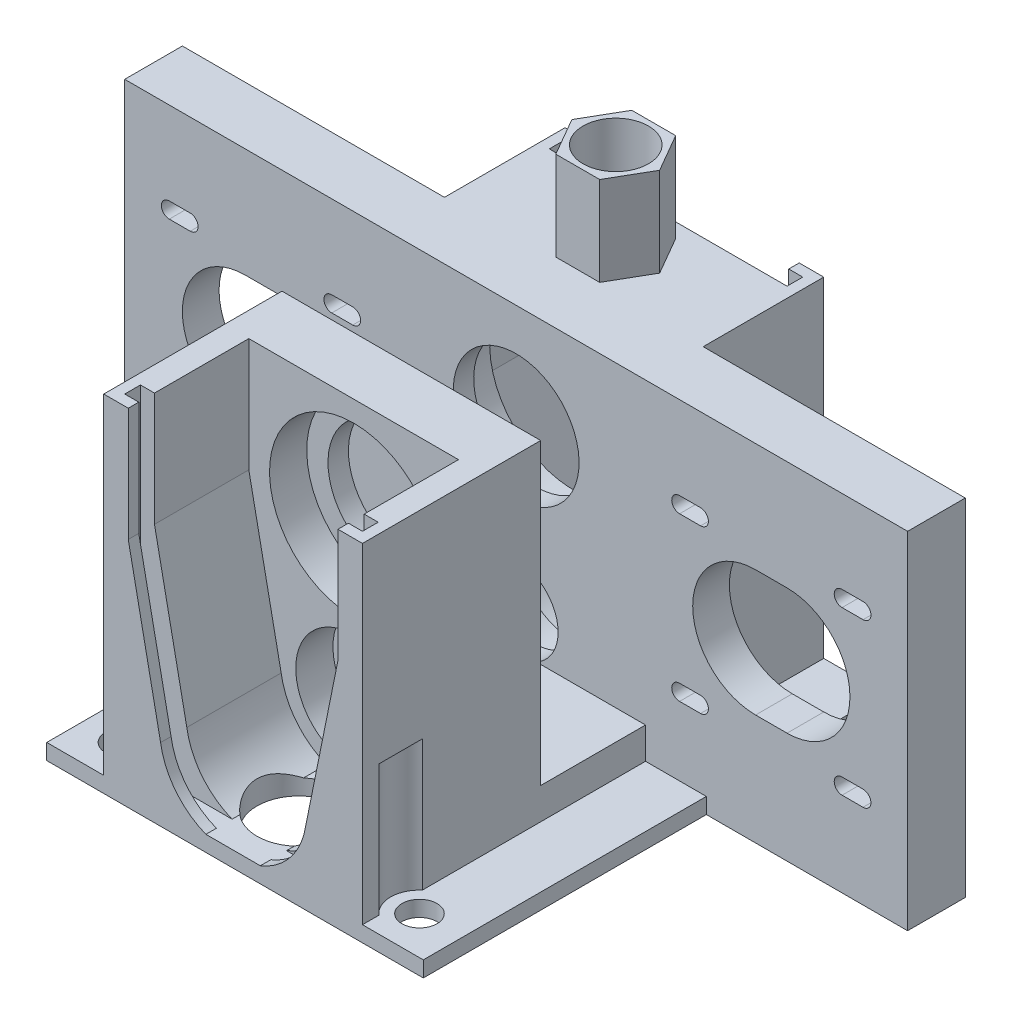
from build123d import *
from build123d.topology import SkipClean

# Parameters (mm, degrees)
SKETCH2_W               = 49.357008476
SKETCH2_H               = 66
BOSS_EXTRUDE1_DEPTH     = 65
SKETCH3_R               = 8
SKETCH3_R_2             = 12
CUT_EXTRUDE1_DEPTH      = 42
CUT_EXTRUDE2_DEPTH      = 92.997168655
SKETCH6_R               = 16.05
SKETCH6_R_2             = 11.05
CUT_EXTRUDE3_DEPTH      = 7.1
CUT_EXTRUDE4_START      = -7.1
SKETCH7_R               = 16.05
SKETCH7_R_2             = 11.05
CUT_EXTRUDE4_DEPTH      = 7.1
SKETCH8_W               = 49.357008476
SKETCH8_H               = 66
BOSS_EXTRUDE2_DEPTH     = 23
CUT_EXTRUDE5_DEPTH      = 105.520232685
CUT_EXTRUDE6_DEPTH      = 20
CUT_EXTRUDE8_REACH      = 106.52
CUT_EXTRUDE8_END_RADIUS = 14
SKETCH12_R              = 8
SKETCH13_W              = 50
SKETCH13_H              = 11
BOSS_EXTRUDE3_DEPTH     = 66
SKETCH15_W              = 46
SKETCH15_H              = 42.3
CUT_EXTRUDE9_DEPTH      = 4
CUT_EXTRUDE10_REACH     = 128.065
SKETCH17_R              = 6.25
BOSS_EXTRUDE4_DEPTH     = 17
CUT_EXTRUDE11_REACH     = 120.987
SKETCH18_R              = 6.25
SKETCH19_R              = 3.346509613
SKETCH19_R_2            = 8
BOSS_EXTRUDE5_DEPTH     = 3
SKETCH20_R              = 5.5
CUT_EXTRUDE12_DEPTH     = 25
CUT_EXTRUDE13_REACH     = 131.193
SKETCH21_R              = 3.346509613
CUT_EXTRUDE14_START     = -63
CUT_EXTRUDE14_OUTLINE_W = 45.357008476
CUT_EXTRUDE14_OUTLINE_H = 3
CUT_EXTRUDE14_DEPTH     = 63
CUT_EXTRUDE15_REACH     = 151.512
SKETCH24_W              = 40
SKETCH24_H              = 2


# Read off the part's stored shape, not the designer's step: Cut-Extrude14
with BuildPart() as part:
    # Sketch2 → Boss-Extrude1 (new body)
    with BuildSketch(Plane(origin=(0, 0, 0), x_dir=(-1, 0, 0), z_dir=(0, 0, -1))):
        with Locations((0, 45.041338207)):
            Rectangle(SKETCH2_W, SKETCH2_H)
    extrude(amount=BOSS_EXTRUDE1_DEPTH)

    # Sketch3 → Cut-Extrude1 (cut)
    with BuildSketch(Plane(origin=(0, 0, 0), x_dir=(-1, 0, 0), z_dir=(0, 0, -1))):
        with Locations(Location((0, 28.041338207, 0), (0, 0, 270))):
            Circle(SKETCH3_R)
        with Locations(Location((0, 58.041338207, 0), (0, 0, 270))):
            Circle(SKETCH3_R_2)
    extrude(amount=CUT_EXTRUDE1_DEPTH, mode=Mode.SUBTRACT)

    # Sketch5 → Cut-Extrude2 (cut, through all)
    with BuildSketch(Plane(origin=(0, 0, -42), x_dir=(-1, 0, 0), z_dir=(0, 0, -1))):
        with BuildLine():
            Line((-20, 76.041338207), (20, 76.041338207))
            Line((20, 76.041338207), (20, 49.50581049))
            Line((20, 49.50581049), (13.804186161, 25.708004874))
            ThreePointArc((13.804186161, 25.708004874), (0, 14.041338207), (-13.804186161, 25.708004874))
            Line((-13.804186161, 25.708004874), (-20, 49.572551396))
            Line((-20, 49.572551396), (-20, 76.041338207))
        make_face()
    extrude(amount=CUT_EXTRUDE2_DEPTH, mode=Mode.SUBTRACT)

    # Sketch6 → Cut-Extrude3 (cut)
    with BuildSketch(Plane(origin=(0, 0, 0), x_dir=(-1, 0, 0), z_dir=(0, 0, -1))):
        with Locations(Location((0, 58.041338207, 0), (0, 0, 90))):
            Circle(SKETCH6_R)
        with Locations(Location((0, 28.041338207, 0), (0, 0, 90))):
            Circle(SKETCH6_R_2)
    extrude(amount=CUT_EXTRUDE3_DEPTH, mode=Mode.SUBTRACT)

    # Sketch7 → Cut-Extrude4 (cut)
    with BuildSketch(Plane(origin=(0, 0, -42), x_dir=(-1, 0, 0), z_dir=(0, 0, -1)).offset(CUT_EXTRUDE4_START)):
        with Locations(Location((0, 58.041338207, 0), (0, 0, 90))):
            Circle(SKETCH7_R)
        with Locations(Location((0, 28.041338207, 0), (0, 0, 90))):
            Circle(SKETCH7_R_2)
    extrude(amount=CUT_EXTRUDE4_DEPTH, mode=Mode.SUBTRACT)

    # Sketch8 → Boss-Extrude2 (add)
    with BuildSketch(Plane(origin=(0, 0, 0), x_dir=(-1, 0, 0), z_dir=(0, 0, -1))):
        with Locations((0, 45.041338207)):
            Rectangle(SKETCH8_W, SKETCH8_H)
    extrude(amount=-BOSS_EXTRUDE2_DEPTH)

    # Sketch9 → Cut-Extrude5 (cut, through all)
    with BuildSketch(Plane(origin=(0, 0, 0), x_dir=(-1, 0, 0), z_dir=(0, 0, -1))):
        with BuildLine():
            Line((20, 78.041338207), (-20, 78.041338207))
            Line((-20, 78.041338207), (-20, 56.351594897))
            Line((-20, 56.351594897), (-13.832556372, 25.882545902))
            ThreePointArc((-13.832556372, 25.882545902), (0, 14.041338207), (13.832556372, 25.882545902))
            Line((13.832556372, 25.882545902), (20, 56.351594897))
            Line((20, 56.351594897), (20, 78.041338207))
        make_face()
    extrude(amount=-CUT_EXTRUDE5_DEPTH, mode=Mode.SUBTRACT)

    # Sketch10 → Cut-Extrude6 (cut)
    with BuildSketch(Plane(origin=(0, 0, -31), x_dir=(-1, 0, 0), z_dir=(0, 0, -1))):
        Polygon((32.017475473, 70.041338207), (32.017475473, 29.218472987), (0.904513973, 21.041338207), (-28.946110104, 21.041338207), (-28.946110104, 62.841225924), (-28.946110104, 84.622444565), (32.017475473, 84.622444565), align=None)
    extrude(amount=-CUT_EXTRUDE6_DEPTH, mode=Mode.SUBTRACT)

    # Cut-Extrude8: up to this cylinder (the profile starts outside it)
    cut_extrude8_end = Plane(origin=(0, 28.041338207, 10.443964), z_dir=(0, 0, -1)) * Cylinder(CUT_EXTRUDE8_END_RADIUS, 242.04, mode=Mode.PRIVATE)
    # Sketch12 → Cut-Extrude8 (cut, up to the surface)
    with BuildSketch(Plane(origin=(0, 0, 0), x_dir=(1, 0, 0), z_dir=(0, 1, 0)), mode=Mode.PRIVATE) as cut_extrude8_sk1:
        with Locations(Location((0, -10.443963659, 0), (0, 0, 90))):
            Circle(SKETCH12_R)
    cut_extrude8_tool1 = extrude(cut_extrude8_sk1.sketch, amount=CUT_EXTRUDE8_REACH, mode=Mode.PRIVATE) - cut_extrude8_end
    add(cut_extrude8_tool1.solids().sort_by_distance((0, 0, 10.443964))[0], mode=Mode.SUBTRACT)

    # Sketch13 → Boss-Extrude3 (add)
    with BuildSketch(Plane(origin=(0, 12.041338207, 0), x_dir=(-1, 0, 0), z_dir=(0, -1, 0))):
        with Locations((49.678504238, 36.5)):
            Rectangle(SKETCH13_W, SKETCH13_H)
        with Locations((-49.678504238, 36.5)):
            Rectangle(SKETCH13_W, SKETCH13_H)
    extrude(amount=-BOSS_EXTRUDE3_DEPTH)

    # Sketch15 → Cut-Extrude9 (cut)
    with BuildSketch(Plane(origin=(0, 0, -42), x_dir=(-1, 0, 0), z_dir=(0, 0, -1))):
        with Locations((48.678504238, 45.191338207)):
            Rectangle(SKETCH15_W, SKETCH15_H)
        with Locations((-48.678504238, 45.191338207)):
            Rectangle(SKETCH15_W, SKETCH15_H)
    extrude(amount=-CUT_EXTRUDE9_DEPTH, mode=Mode.SUBTRACT)

    # Sketch16 → Cut-Extrude10 (cut, up to next)
    with BuildSketch(Plane(origin=(0, 0, -42), x_dir=(-1, 0, 0), z_dir=(0, 0, -1)), mode=Mode.PRIVATE) as cut_extrude10_sk1:
        with BuildLine():
            Line((45.678504238, 57.191338207), (51.678504238, 57.191338207))
            ThreePointArc((51.678504238, 57.191338207), (63.678504238, 45.191338207), (51.678504238, 33.191338207))
            Line((51.678504238, 33.191338207), (45.678504238, 33.191338207))
            ThreePointArc((45.678504238, 33.191338207), (33.678504238, 45.191338207), (45.678504238, 57.191338207))
        make_face()
    cut_extrude10_tool1 = extrude(cut_extrude10_sk1.sketch, amount=-CUT_EXTRUDE10_REACH, mode=Mode.PRIVATE) & part.part
    # Sketch16 → Cut-Extrude10 (cut, up to next)
    with BuildSketch(Plane(origin=(0, 0, -42), x_dir=(-1, 0, 0), z_dir=(0, 0, -1)), mode=Mode.PRIVATE) as cut_extrude10_sk2:
        with BuildLine():
            Line((31.178504238, 62.191338207), (35.178504238, 62.191338207))
            ThreePointArc((35.178504238, 62.191338207), (36.678504238, 60.691338207), (35.178504238, 59.191338207))
            Line((35.178504238, 59.191338207), (31.178504238, 59.191338207))
            ThreePointArc((31.178504238, 59.191338207), (29.678504238, 60.691338207), (31.178504238, 62.191338207))
        make_face()
    cut_extrude10_tool2 = extrude(cut_extrude10_sk2.sketch, amount=-CUT_EXTRUDE10_REACH, mode=Mode.PRIVATE) & part.part
    # Sketch16 → Cut-Extrude10 (cut, up to next)
    with BuildSketch(Plane(origin=(0, 0, -42), x_dir=(-1, 0, 0), z_dir=(0, 0, -1)), mode=Mode.PRIVATE) as cut_extrude10_sk3:
        with BuildLine():
            Line((66.178504238, 62.191338207), (62.178504238, 62.191338207))
            ThreePointArc((62.178504238, 62.191338207), (60.678504238, 60.691338207), (62.178504238, 59.191338207))
            Line((62.178504238, 59.191338207), (66.178504238, 59.191338207))
            ThreePointArc((66.178504238, 59.191338207), (67.678504238, 60.691338207), (66.178504238, 62.191338207))
        make_face()
    cut_extrude10_tool3 = extrude(cut_extrude10_sk3.sketch, amount=-CUT_EXTRUDE10_REACH, mode=Mode.PRIVATE) & part.part
    # Sketch16 → Cut-Extrude10 (cut, up to next)
    with BuildSketch(Plane(origin=(0, 0, -42), x_dir=(-1, 0, 0), z_dir=(0, 0, -1)), mode=Mode.PRIVATE) as cut_extrude10_sk4:
        with BuildLine():
            Line((31.178504238, 28.191338207), (35.178504238, 28.191338207))
            ThreePointArc((35.178504238, 28.191338207), (36.678504238, 29.691338207), (35.178504238, 31.191338207))
            Line((35.178504238, 31.191338207), (31.178504238, 31.191338207))
            ThreePointArc((31.178504238, 31.191338207), (29.678504238, 29.691338207), (31.178504238, 28.191338207))
        make_face()
    cut_extrude10_tool4 = extrude(cut_extrude10_sk4.sketch, amount=-CUT_EXTRUDE10_REACH, mode=Mode.PRIVATE) & part.part
    # Sketch16 → Cut-Extrude10 (cut, up to next)
    with BuildSketch(Plane(origin=(0, 0, -42), x_dir=(-1, 0, 0), z_dir=(0, 0, -1)), mode=Mode.PRIVATE) as cut_extrude10_sk5:
        with BuildLine():
            Line((66.178504238, 28.191338207), (62.178504238, 28.191338207))
            ThreePointArc((62.178504238, 28.191338207), (60.678504238, 29.691338207), (62.178504238, 31.191338207))
            Line((62.178504238, 31.191338207), (66.178504238, 31.191338207))
            ThreePointArc((66.178504238, 31.191338207), (67.678504238, 29.691338207), (66.178504238, 28.191338207))
        make_face()
    cut_extrude10_tool5 = extrude(cut_extrude10_sk5.sketch, amount=-CUT_EXTRUDE10_REACH, mode=Mode.PRIVATE) & part.part
    # Sketch16 → Cut-Extrude10 (cut, up to next)
    with BuildSketch(Plane(origin=(0, 0, -42), x_dir=(-1, 0, 0), z_dir=(0, 0, -1)), mode=Mode.PRIVATE) as cut_extrude10_sk6:
        with BuildLine():
            Line((-45.678504238, 57.191338207), (-51.678504238, 57.191338207))
            ThreePointArc((-51.678504238, 57.191338207), (-63.678504238, 45.191338207), (-51.678504238, 33.191338207))
            Line((-51.678504238, 33.191338207), (-45.678504238, 33.191338207))
            ThreePointArc((-45.678504238, 33.191338207), (-33.678504238, 45.191338207), (-45.678504238, 57.191338207))
        make_face()
    cut_extrude10_tool6 = extrude(cut_extrude10_sk6.sketch, amount=-CUT_EXTRUDE10_REACH, mode=Mode.PRIVATE) & part.part
    # Sketch16 → Cut-Extrude10 (cut, up to next)
    with BuildSketch(Plane(origin=(0, 0, -42), x_dir=(-1, 0, 0), z_dir=(0, 0, -1)), mode=Mode.PRIVATE) as cut_extrude10_sk7:
        with BuildLine():
            Line((-31.178504238, 62.191338207), (-35.178504238, 62.191338207))
            ThreePointArc((-35.178504238, 62.191338207), (-36.678504238, 60.691338207), (-35.178504238, 59.191338207))
            Line((-35.178504238, 59.191338207), (-31.178504238, 59.191338207))
            ThreePointArc((-31.178504238, 59.191338207), (-29.678504238, 60.691338207), (-31.178504238, 62.191338207))
        make_face()
    cut_extrude10_tool7 = extrude(cut_extrude10_sk7.sketch, amount=-CUT_EXTRUDE10_REACH, mode=Mode.PRIVATE) & part.part
    # Sketch16 → Cut-Extrude10 (cut, up to next)
    with BuildSketch(Plane(origin=(0, 0, -42), x_dir=(-1, 0, 0), z_dir=(0, 0, -1)), mode=Mode.PRIVATE) as cut_extrude10_sk8:
        with BuildLine():
            Line((-66.178504238, 62.191338207), (-62.178504238, 62.191338207))
            ThreePointArc((-62.178504238, 62.191338207), (-60.678504238, 60.691338207), (-62.178504238, 59.191338207))
            Line((-62.178504238, 59.191338207), (-66.178504238, 59.191338207))
            ThreePointArc((-66.178504238, 59.191338207), (-67.678504238, 60.691338207), (-66.178504238, 62.191338207))
        make_face()
    cut_extrude10_tool8 = extrude(cut_extrude10_sk8.sketch, amount=-CUT_EXTRUDE10_REACH, mode=Mode.PRIVATE) & part.part
    # Sketch16 → Cut-Extrude10 (cut, up to next)
    with BuildSketch(Plane(origin=(0, 0, -42), x_dir=(-1, 0, 0), z_dir=(0, 0, -1)), mode=Mode.PRIVATE) as cut_extrude10_sk9:
        with BuildLine():
            Line((-31.178504238, 28.191338207), (-35.178504238, 28.191338207))
            ThreePointArc((-35.178504238, 28.191338207), (-36.678504238, 29.691338207), (-35.178504238, 31.191338207))
            Line((-35.178504238, 31.191338207), (-31.178504238, 31.191338207))
            ThreePointArc((-31.178504238, 31.191338207), (-29.678504238, 29.691338207), (-31.178504238, 28.191338207))
        make_face()
    cut_extrude10_tool9 = extrude(cut_extrude10_sk9.sketch, amount=-CUT_EXTRUDE10_REACH, mode=Mode.PRIVATE) & part.part
    # Sketch16 → Cut-Extrude10 (cut, up to next)
    with BuildSketch(Plane(origin=(0, 0, -42), x_dir=(-1, 0, 0), z_dir=(0, 0, -1)), mode=Mode.PRIVATE) as cut_extrude10_sk10:
        with BuildLine():
            Line((-66.178504238, 28.191338207), (-62.178504238, 28.191338207))
            ThreePointArc((-62.178504238, 28.191338207), (-60.678504238, 29.691338207), (-62.178504238, 31.191338207))
            Line((-62.178504238, 31.191338207), (-66.178504238, 31.191338207))
            ThreePointArc((-66.178504238, 31.191338207), (-67.678504238, 29.691338207), (-66.178504238, 28.191338207))
        make_face()
    cut_extrude10_tool10 = extrude(cut_extrude10_sk10.sketch, amount=-CUT_EXTRUDE10_REACH, mode=Mode.PRIVATE) & part.part
    add(cut_extrude10_tool1.solids().sort_by_distance((-48.678504, 45.191338, -42))[0], mode=Mode.SUBTRACT)
    add(cut_extrude10_tool2.solids().sort_by_distance((-33.178504, 60.691338, -42))[0], mode=Mode.SUBTRACT)
    add(cut_extrude10_tool3.solids().sort_by_distance((-64.178504, 60.691338, -42))[0], mode=Mode.SUBTRACT)
    add(cut_extrude10_tool4.solids().sort_by_distance((-33.178504, 29.691338, -42))[0], mode=Mode.SUBTRACT)
    add(cut_extrude10_tool5.solids().sort_by_distance((-64.178504, 29.691338, -42))[0], mode=Mode.SUBTRACT)
    add(cut_extrude10_tool6.solids().sort_by_distance((48.678504, 45.191338, -42))[0], mode=Mode.SUBTRACT)
    add(cut_extrude10_tool7.solids().sort_by_distance((33.178504, 60.691338, -42))[0], mode=Mode.SUBTRACT)
    add(cut_extrude10_tool8.solids().sort_by_distance((64.178504, 60.691338, -42))[0], mode=Mode.SUBTRACT)
    add(cut_extrude10_tool9.solids().sort_by_distance((33.178504, 29.691338, -42))[0], mode=Mode.SUBTRACT)
    add(cut_extrude10_tool10.solids().sort_by_distance((64.178504, 29.691338, -42))[0], mode=Mode.SUBTRACT)

    # Sketch17 → Boss-Extrude4 (add)
    with BuildSketch(Plane(origin=(0, 78.041338207, 0), x_dir=(1, 0, 0), z_dir=(0, 1, 0))):
        Polygon((8.371578903, 50), (4.185789452, 57.25), (-4.185789452, 57.25), (-8.371578903, 50), (-4.185789452, 42.75), (4.185789452, 42.75), align=None)
        with Locations(Location((0, 50, 0), (0, 0, 270))):
            Circle(SKETCH17_R, mode=Mode.SUBTRACT)
    extrude(amount=BOSS_EXTRUDE4_DEPTH)

    # Sketch18 → Cut-Extrude11 (cut, up to next)
    with BuildSketch(Plane(origin=(0, 78.041338207, 0), x_dir=(1, 0, 0), z_dir=(0, 1, 0)), mode=Mode.PRIVATE) as cut_extrude11_sk1:
        with Locations(Location((0, 50, 0), (0, 0, 90))):
            Circle(SKETCH18_R)
    cut_extrude11_tool1 = extrude(cut_extrude11_sk1.sketch, amount=-CUT_EXTRUDE11_REACH, mode=Mode.PRIVATE) & part.part
    add(cut_extrude11_tool1.solids().sort_by_distance((0, 78.041338, -50))[0], mode=Mode.SUBTRACT)

    # Sketch19 → Boss-Extrude5 (add)
    with BuildSketch(Plane(origin=(0, 12.041338207, 0), x_dir=(-1, 0, 0), z_dir=(0, -1, 0))):
        Polygon((-36.284271247, 48.840307588), (-36.284271247, -23), (35.556036341, -23), (35.556036341, 48.840307588), (35.556036341, 65), (-36.284271247, 65), align=None)
        with Locations((-28.284271247, 40.840307588)):
            Circle(SKETCH19_R, mode=Mode.SUBTRACT)
        with Locations((28.284271247, 40.840307588)):
            Circle(SKETCH19_R, mode=Mode.SUBTRACT)
        with Locations(Location((-28.284271247, -15.728234907, 0), (0, 0, 270))):
            Circle(SKETCH19_R, mode=Mode.SUBTRACT)
        with Locations(Location((28.284271247, -15.728234907, 0), (0, 0, 270))):
            Circle(SKETCH19_R, mode=Mode.SUBTRACT)
        with Locations(Location((0, -10.443963659, 0), (0, 0, 49.494650345))):
            Circle(SKETCH19_R_2, mode=Mode.SUBTRACT)
    extrude(amount=-BOSS_EXTRUDE5_DEPTH)

    # Sketch20 → Cut-Extrude12 (cut)
    with BuildSketch(Plane(origin=(0, 15.041338207, 0), x_dir=(1, 0, 0), z_dir=(0, 1, 0))):
        with Locations((-28.284271247, -15.728234907)):
            Circle(SKETCH20_R)
        with Locations((28.284271247, -15.728234907)):
            Circle(SKETCH20_R)
        with Locations((28.284271247, 40.840307588)):
            Circle(SKETCH20_R)
        with Locations((-28.284271247, 40.840307588)):
            Circle(SKETCH20_R)
    extrude(amount=CUT_EXTRUDE12_DEPTH, mode=Mode.SUBTRACT)

    # Sketch21 → Cut-Extrude13 (cut, up to next)
    with BuildSketch(Plane(origin=(0, 12.041338207, 0), x_dir=(-1, 0, 0), z_dir=(0, -1, 0)), mode=Mode.PRIVATE) as cut_extrude13_sk1:
        with Locations(Location((-28.284271247, 40.840307588, 0), (0, 0, 90))):
            Circle(SKETCH21_R)
    cut_extrude13_tool1 = extrude(cut_extrude13_sk1.sketch, amount=-CUT_EXTRUDE13_REACH, mode=Mode.PRIVATE) & part.part
    # Sketch21 → Cut-Extrude13 (cut, up to next)
    with BuildSketch(Plane(origin=(0, 12.041338207, 0), x_dir=(-1, 0, 0), z_dir=(0, -1, 0)), mode=Mode.PRIVATE) as cut_extrude13_sk2:
        with Locations(Location((28.284271247, 40.840307588, 0), (0, 0, 270))):
            Circle(SKETCH21_R)
    cut_extrude13_tool2 = extrude(cut_extrude13_sk2.sketch, amount=-CUT_EXTRUDE13_REACH, mode=Mode.PRIVATE) & part.part
    add(cut_extrude13_tool1.solids().sort_by_distance((28.284271, 12.041338, -40.840308))[0], mode=Mode.SUBTRACT)
    add(cut_extrude13_tool2.solids().sort_by_distance((-28.284271, 12.041338, -40.840308))[0], mode=Mode.SUBTRACT)

    # Cut-Extrude14 outline → Cut-Extrude14 (cut)
    with SkipClean():  # the faces are left unmerged after this step: merging them gives an invalid solid
        with BuildSketch(Plane(origin=(0, 78.041338207, 0), x_dir=(1, 0, 0), z_dir=(0, 1, 0)).offset(CUT_EXTRUDE14_START)):
            with Locations((0, 61.5)):
                Rectangle(CUT_EXTRUDE14_OUTLINE_W, CUT_EXTRUDE14_OUTLINE_H)
            with Locations((0, -19.5)):
                Rectangle(CUT_EXTRUDE14_OUTLINE_W, CUT_EXTRUDE14_OUTLINE_H)
        extrude(amount=CUT_EXTRUDE14_DEPTH, mode=Mode.SUBTRACT)

    # Sketch24 → Cut-Extrude15 (cut, up to next)
    with BuildSketch(Plane(origin=(0, 0, -65), x_dir=(-1, 0, 0), z_dir=(0, 0, -1)), mode=Mode.PRIVATE) as cut_extrude15_sk1:
        with Locations((0, 77.041338207)):
            Rectangle(SKETCH24_W, SKETCH24_H)
    cut_extrude15_tool1 = extrude(cut_extrude15_sk1.sketch, amount=-CUT_EXTRUDE15_REACH, mode=Mode.PRIVATE) & part.part
    add(cut_extrude15_tool1.solids().sort_by_distance((0, 77.041338, -65))[0], mode=Mode.SUBTRACT)


solid = part.part
